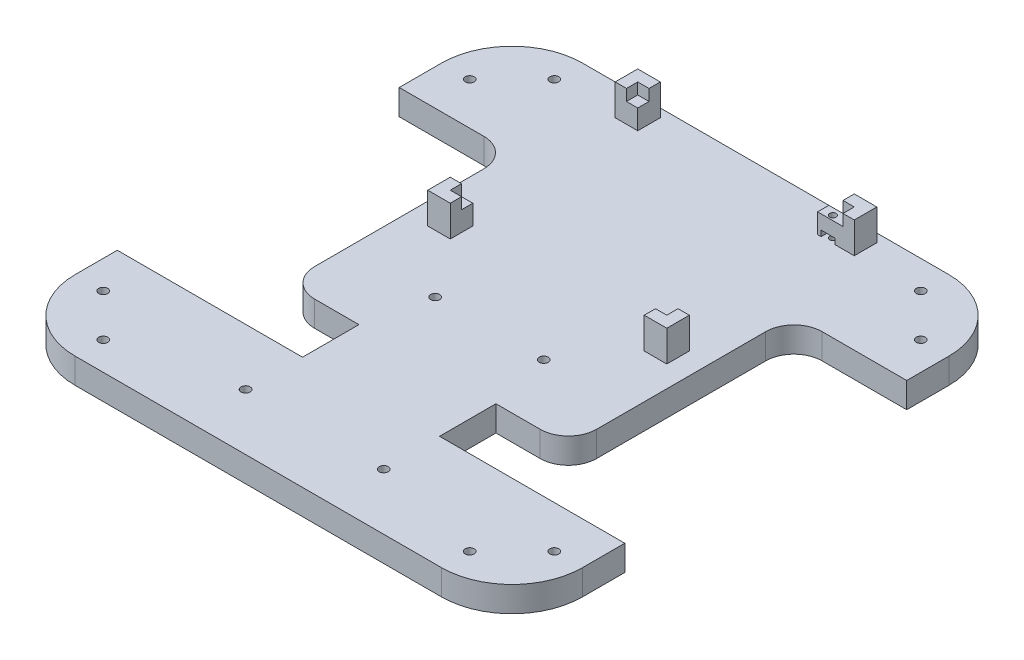
from build123d import *

# Parameters (mm, degrees)
PLATE_DEPTH         = 9
SKETCH3_R           = 1.6
HEX_HOLES_DEPTH     = 128.597021909
SKETCH4_R           = 1.6
ARDUINO_HOLES_DEPTH = 128.597021909
SKETCH5_W           = 40
SKETCH5_H           = 100
CUT_EXTRUDE1_DEPTH  = 128.597021909
SKETCH10_W          = 25.7
SKETCH10_H          = 20
CUT_EXTRUDE4_DEPTH  = 10
FILLET1_R           = 10
BOSS_EXTRUDE1_DEPTH = 11
SKETCH7_W           = 4
SKETCH7_H           = 4
SKETCH7_W_2         = 9
BOSS_EXTRUDE2_DEPTH = 7
SKETCH8_R           = 1.15
CUT_EXTRUDE2_DEPTH  = 129.280941687
SKETCH9_W           = 5
SKETCH9_H           = 2
CUT_EXTRUDE3_DEPTH  = 193.512337267


with BuildPart() as part:
    # Sketch1 → Plate (new body)
    with BuildSketch(Plane(origin=(0, 0, 0), x_dir=(1, 0, 0), z_dir=(0, 1, 0))):
        with BuildLine():
            Line((-65, -90), (65, -90))
            ThreePointArc((65, -90), (82.67766953, -82.67766953), (90, -65))
            Line((90, -65), (90, 65))
            ThreePointArc((90, 65), (82.67766953, 82.67766953), (65, 90))
            Line((65, 90), (-65, 90))
            ThreePointArc((-65, 90), (-82.67766953, 82.67766953), (-90, 65))
            Line((-90, 65), (-90, -65))
            ThreePointArc((-90, -65), (-82.67766953, -82.67766953), (-65, -90))
        make_face()
    extrude(amount=PLATE_DEPTH)

    # Sketch3 → Hex Holes (cut, through all)
    with BuildSketch(Plane(origin=(0, 9, 0), x_dir=(1, 0, 0), z_dir=(0, 1, 0))):
        with Locations((-65, 80)):
            Circle(SKETCH3_R)
        with Locations((-80, 65)):
            Circle(SKETCH3_R)
        with Locations((80, 65)):
            Circle(SKETCH3_R)
        with Locations((80, -65)):
            Circle(SKETCH3_R)
        with Locations((65, 80)):
            Circle(SKETCH3_R)
        with Locations((65, -80)):
            Circle(SKETCH3_R)
        with Locations((-65, -80)):
            Circle(SKETCH3_R)
        with Locations((-80, -65)):
            Circle(SKETCH3_R)
    extrude(amount=-HEX_HOLES_DEPTH, mode=Mode.SUBTRACT)

    # Sketch4 → Arduino Holes (cut, through all)
    with BuildSketch(Plane(origin=(0, 9, 0), x_dir=(1, 0, 0), z_dir=(0, 1, 0))):
        with Locations((-24.5, -70)):
            Circle(SKETCH4_R)
        with Locations((24.5, -70)):
            Circle(SKETCH4_R)
        with Locations((-19.25, -8)):
            Circle(SKETCH4_R)
        with Locations((19.25, -8)):
            Circle(SKETCH4_R)
    extrude(amount=-ARDUINO_HOLES_DEPTH, mode=Mode.SUBTRACT)

    # Sketch5 → Cut-Extrude1 (cut, through all)
    with BuildSketch(Plane(origin=(0, 9, 0), x_dir=(1, 0, 0), z_dir=(0, 1, 0))):
        with Locations((-70, 0)):
            Rectangle(SKETCH5_W, SKETCH5_H)
        with Locations((70, 0)):
            Rectangle(SKETCH5_W, SKETCH5_H)
    extrude(amount=-CUT_EXTRUDE1_DEPTH, mode=Mode.SUBTRACT)

    # Sketch10 → Cut-Extrude4 (cut)
    with BuildSketch(Plane(origin=(0, 9, 0), x_dir=(1, 0, 0), z_dir=(0, 1, 0))):
        with Locations((-37.15, -40)):
            Rectangle(SKETCH10_W, SKETCH10_H)
        with Locations((37.15, -40)):
            Rectangle(SKETCH10_W, SKETCH10_H)
    extrude(amount=-CUT_EXTRUDE4_DEPTH, mode=Mode.SUBTRACT)

    # Fillet1
    fillet1_edges = [part.edges().sort_by_distance(p)[0] for p in [
        (50, 4.5, -50),
        (-50, 4.5, -50),
        (50, 4.5, 30),
        (-50, 4.5, 30),
    ]]
    fillet(fillet1_edges, radius=FILLET1_R)

    # Sketch6 → Boss-Extrude1 (add)
    with BuildSketch(Plane(origin=(0, 9, 0), x_dir=(1, 0, 0), z_dir=(0, 1, 0))):
        Polygon((34.4, 83), (38.4, 83), (38.4, 79), (42.4, 79), (42.4, 87), (34.4, 87), align=None)
        Polygon((38.4, 20.5), (38.4, 16.5), (34.4, 16.5), (34.4, 12.5), (42.4, 12.5), (42.4, 20.5), align=None)
        Polygon((-38.4, 16.5), (-34.4, 16.5), (-34.4, 12.5), (-42.4, 12.5), (-42.4, 20.5), (-38.4, 20.5), align=None)
        Polygon((-38.4, 83), (-34.4, 83), (-34.4, 87), (-42.4, 87), (-42.4, 79), (-38.4, 79), align=None)
    extrude(amount=BOSS_EXTRUDE1_DEPTH)

    # Sketch7 → Boss-Extrude2 (add)
    with BuildSketch(Plane(origin=(0, 9, 0), x_dir=(1, 0, 0), z_dir=(0, 1, 0))):
        with Locations((-36.4, 18.5)):
            Rectangle(SKETCH7_W, SKETCH7_H)
        with Locations((36.4, 18.5)):
            Rectangle(SKETCH7_W, SKETCH7_H)
        with Locations((-36.4, 81)):
            Rectangle(SKETCH7_W, SKETCH7_H)
        with Locations((33.9, 81)):
            Rectangle(SKETCH7_W_2, SKETCH7_H)
    extrude(amount=BOSS_EXTRUDE2_DEPTH)

    # Sketch8 → Cut-Extrude2 (cut, through all)
    with BuildSketch(Plane(origin=(0, 16, 0), x_dir=(1, 0, 0), z_dir=(0, 1, 0))):
        with Locations((33.15, 80.65)):
            Circle(SKETCH8_R)
    extrude(amount=-CUT_EXTRUDE2_DEPTH, mode=Mode.SUBTRACT)

    # Sketch9 → Cut-Extrude3 (cut, through all)
    with BuildSketch(Plane.XY.offset(-79)):
        with Locations((33.15, 10)):
            Rectangle(SKETCH9_W, SKETCH9_H)
    extrude(amount=-CUT_EXTRUDE3_DEPTH, mode=Mode.SUBTRACT)


solid = part.part
